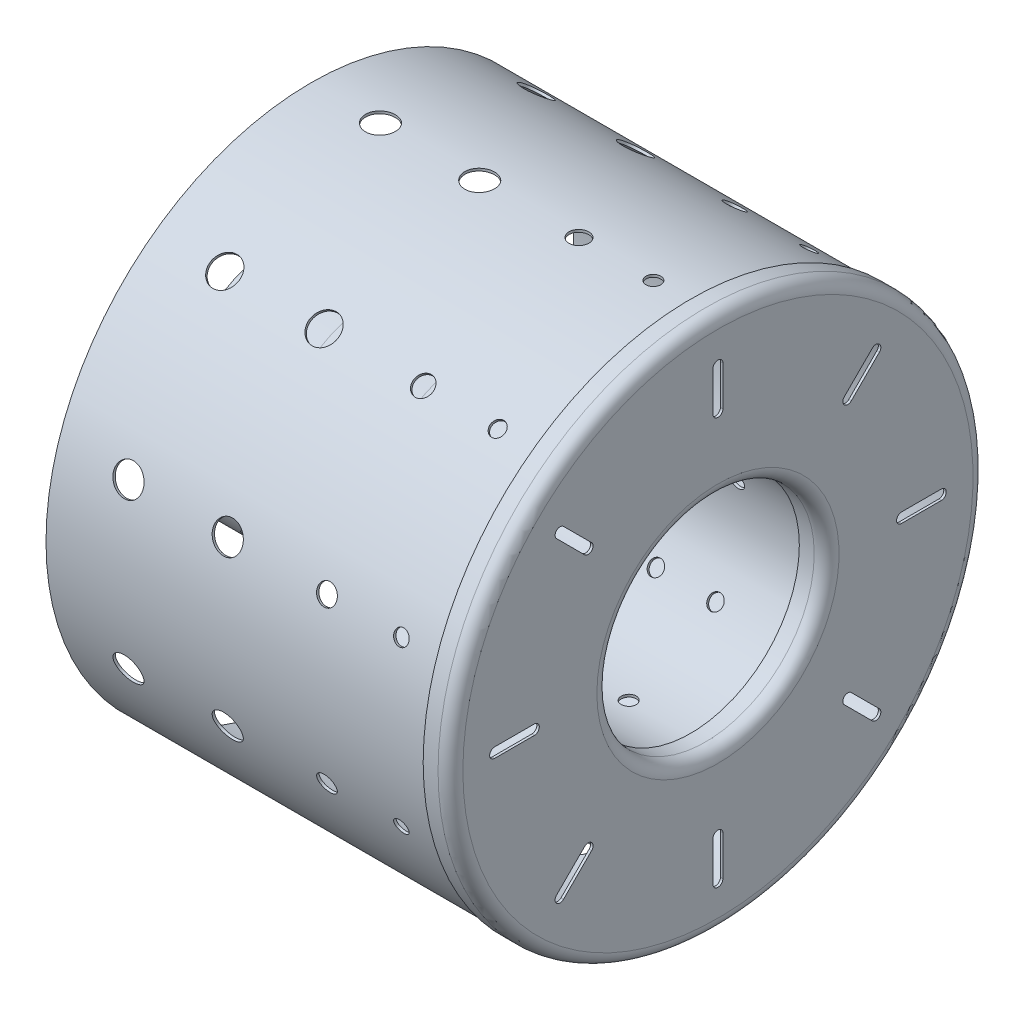
from build123d import *

# Parameters (mm, degrees)
IZIM5_R                 = 2
IZIM5_R_2               = 1.5
KES_EKSTR_ZYON2_DEPTH   = 10
DAIRESEL_KAPLAMA2_COUNT = 7
IZIM8_R                 = 3.5
KES_EKSTR_ZYON3_DEPTH   = 10
DAIRESEL_KAPLAMA3_COUNT = 7
IZIM9_W                 = 79.5
IZIM9_H                 = 0.5
IZIM10_R                = 3
IZIM10_R_2              = 2
IZIM10_R_3              = 1.5
KES_EKSTR_ZYON4_DEPTH   = 10
DAIRESEL_KAPLAMA4_COUNT = 10
KES_EKSTR_ZYON5_DEPTH   = 10
DAIRESEL_KAPLAMA5_COUNT = 8


with BuildPart() as part:
    # Çizim1 → Döndür2 (revolve)
    with BuildSketch(Plane.XY, mode=Mode.PRIVATE) as d_nd_r2_sk:
        with BuildLine():
            Line((-4.191763475, 22.4), (15.279255583, 22.4))
            ThreePointArc((15.279255583, 22.4), (15.800200116, 22.354423259), (16.305316013, 22.219077862))
            Line((16.305316013, 22.219077862), (23.145456105, 19.729470471))
            ThreePointArc((23.145456105, 19.729470471), (24.040658373, 19.551403668), (24.94797367, 19.650770854))
            Line((24.94797367, 19.650770854), (34.826736882, 22.297777479))
            ThreePointArc((34.826736882, 22.297777479), (35.211615441, 22.374334584), (35.603194018, 22.4))
            Line((35.603194018, 22.4), (80.808236525, 22.4))
            Line((80.808236525, 22.4), (80.808236525, 22.9))
            Line((80.808236525, 22.9), (35.603194018, 22.9))
            ThreePointArc((35.603194018, 22.9), (35.146352345, 22.870057015), (34.69732736, 22.780740392))
            Line((34.69732736, 22.780740392), (24.818564148, 20.133733767))
            ThreePointArc((24.818564148, 20.133733767), (24.062468067, 20.050927779), (23.316466177, 20.199316781))
            Line((23.316466177, 20.199316781), (16.476326084, 22.688924173))
            ThreePointArc((16.476326084, 22.688924173), (15.887024204, 22.846827136), (15.279255583, 22.9))
            Line((15.279255583, 22.9), (-4.191763475, 22.9))
            Line((-4.191763475, 22.9), (-4.191763475, 22.4))
        make_face()
    revolve(d_nd_r2_sk.sketch.rotate(Axis((0, 0, 0), (1, 0, 0)), 90), axis=Axis((0, 0, 0), (1, 0, 0)))

    # Çizim5 → Kes-Ekstrüzyon2 (cut)
    with BuildSketch(Plane(origin=(0, -22.9, 0), x_dir=(-1, 0, 0), z_dir=(0, -1, 0))):
        with Locations(Location((-7.808236525, 0, 0), (0, 0, 90))):
            Circle(IZIM5_R)
        with Locations(Location((-41.808236525, 0, 0), (0, 0, 90))):
            Circle(IZIM5_R)
        with Locations(Location((-53.808236525, 0, 0), (0, 0, 90))):
            Circle(IZIM5_R_2)
        with Locations(Location((-65.808236525, 0, 0), (0, 0, 90))):
            Circle(IZIM5_R_2)
    kes_ekstr_zyon2 = extrude(amount=-KES_EKSTR_ZYON2_DEPTH, mode=Mode.SUBTRACT)

    # Dairesel Kaplama2: Kes-Ekstrüzyon2 ×7 about axis
    dairesel_kaplama2_axis = Axis((-4.191763475, 0, 0), (-1, 0, 0))
    for i in range(1, DAIRESEL_KAPLAMA2_COUNT):
        add(kes_ekstr_zyon2.rotate(dairesel_kaplama2_axis, i * 360 / DAIRESEL_KAPLAMA2_COUNT), mode=Mode.SUBTRACT)

    # Çizim6 → Döndür3 (revolve)
    with BuildSketch(Plane.XY, mode=Mode.PRIVATE) as d_nd_r3_sk:
        with BuildLine():
            Line((78.308236525, 22.4), (81.308236525, 22.4))
            ThreePointArc((81.308236525, 22.4), (82.722450087, 22.985786438), (83.308236525, 24.4))
            Line((83.308236525, 24.4), (83.308236525, 51.4))
            ThreePointArc((83.308236525, 51.4), (82.722450087, 52.814213562), (81.308236525, 53.4))
            Line((81.308236525, 53.4), (78.308236525, 53.4))
            Line((78.308236525, 53.4), (78.308236525, 53.9))
            Line((78.308236525, 53.9), (81.308236525, 53.9))
            ThreePointArc((81.308236525, 53.9), (83.076003478, 53.167766953), (83.808236525, 51.4))
            Line((83.808236525, 51.4), (83.808236525, 24.4))
            ThreePointArc((83.808236525, 24.4), (83.076003478, 22.632233047), (81.308236525, 21.9))
            Line((81.308236525, 21.9), (78.308236525, 21.9))
            Line((78.308236525, 21.9), (78.308236525, 22.4))
        make_face()
    revolve(d_nd_r3_sk.sketch.rotate(Axis((0, 0, 0), (1, 0, 0)), 90), axis=Axis((0, 0, 0), (1, 0, 0)))

    # Çizim8 → Kes-Ekstrüzyon3 (cut)
    with BuildSketch(Plane(origin=(9.21944369, 25.330213358, 0), x_dir=(0.9396926207859082, -0.3420201433256695, 0), z_dir=(0.3420201433256695, 0.9396926207859082, 0))):
        with Locations(Location((11.362175465, 0, 0), (0, 0, 119.950202109))):
            Circle(IZIM8_R)
    kes_ekstr_zyon3 = extrude(amount=-KES_EKSTR_ZYON3_DEPTH, mode=Mode.SUBTRACT)

    # Dairesel Kaplama3: Kes-Ekstrüzyon3 ×7 about axis
    dairesel_kaplama3_axis = Axis((0, 0, 0), (-1, 0, 0))
    for i in range(1, DAIRESEL_KAPLAMA3_COUNT):
        add(kes_ekstr_zyon3.rotate(dairesel_kaplama3_axis, i * 360 / DAIRESEL_KAPLAMA3_COUNT), mode=Mode.SUBTRACT)

    # Çizim9 → Döndür4 (revolve)
    with BuildSketch(Plane.XY, mode=Mode.PRIVATE) as d_nd_r4_sk:
        with Locations((41.558236525, 53.15)):
            Rectangle(IZIM9_W, IZIM9_H)
    revolve(d_nd_r4_sk.sketch.rotate(Axis((-7.238035878, 0, 0), (1, 0, 0)), 90), axis=Axis((-7.238035878, 0, 0), (1, 0, 0)))

    # Çizim10 → Kes-Ekstrüzyon4 (cut)
    with BuildSketch(Plane(origin=(0, 53.4, 0), x_dir=(1, 0, 0), z_dir=(0, 1, 0))):
        with Locations(Location((15.808236525, 0, 0), (0, 0, 270))):
            Circle(IZIM10_R)
        with Locations(Location((35.808236525, 0, 0), (0, 0, 270))):
            Circle(IZIM10_R)
        with Locations(Location((55.808236525, 0, 0), (0, 0, 270))):
            Circle(IZIM10_R_2)
        with Locations(Location((70.808236525, 0, 0), (0, 0, 270))):
            Circle(IZIM10_R_3)
    kes_ekstr_zyon4 = extrude(amount=-KES_EKSTR_ZYON4_DEPTH, mode=Mode.SUBTRACT)

    # Dairesel Kaplama4: Kes-Ekstrüzyon4 ×10 about axis
    dairesel_kaplama4_axis = Axis((-7.238035878, 0, 0), (-1, 0, 0))
    for i in range(1, DAIRESEL_KAPLAMA4_COUNT):
        add(kes_ekstr_zyon4.rotate(dairesel_kaplama4_axis, i * 360 / DAIRESEL_KAPLAMA4_COUNT), mode=Mode.SUBTRACT)

    # Çizim11 → Kes-Ekstrüzyon5 (cut)
    with BuildSketch(Plane(origin=(83.808236525, 0, 0), x_dir=(0, 0, -1), z_dir=(1, 0, 0))):
        with BuildLine():
            Line((1, 45), (1, 37))
            ThreePointArc((1, 37), (0, 36), (-1, 37))
            Line((-1, 37), (-1, 45))
            ThreePointArc((-1, 45), (0, 46), (1, 45))
        make_face()
    kes_ekstr_zyon5 = extrude(amount=-KES_EKSTR_ZYON5_DEPTH, mode=Mode.SUBTRACT)

    # Dairesel Kaplama5: Kes-Ekstrüzyon5 ×8 about axis
    dairesel_kaplama5_axis = Axis((0, 0, 0), (1, 0, 0))
    for i in range(1, DAIRESEL_KAPLAMA5_COUNT):
        add(kes_ekstr_zyon5.rotate(dairesel_kaplama5_axis, i * 360 / DAIRESEL_KAPLAMA5_COUNT), mode=Mode.SUBTRACT)


solid = part.part
